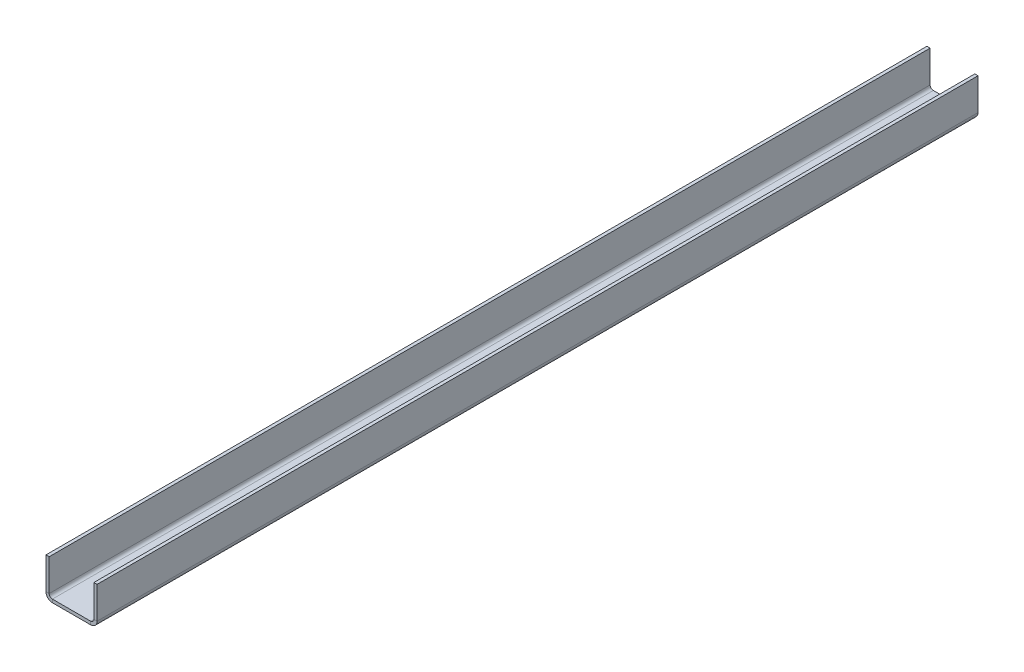
from build123d import *

# Parameters (mm, degrees)
BASE_FLANGE1_DEPTH = 876.3


# Sheet-metal steps are written as plain solids
with BuildPart() as part:
    # Sketch1 → Base-Flange1 (new body)
    with BuildSketch(Plane.XY):
        with BuildLine():
            Line((50.8, 38.1), (50.8, 6.35))
            ThreePointArc((50.8, 6.35), (48.940128061, 1.859871939), (44.45, 0))
            Line((44.45, 0), (6.35, 0))
            ThreePointArc((6.35, 0), (1.859871939, 1.859871939), (0, 6.35))
            Line((0, 6.35), (0, 38.1))
            Line((0, 38.1), (3.175, 38.1))
            Line((3.175, 38.1), (3.175, 6.35))
            ThreePointArc((3.175, 6.35), (4.10493597, 4.10493597), (6.35, 3.175))
            Line((6.35, 3.175), (44.45, 3.175))
            ThreePointArc((44.45, 3.175), (46.69506403, 4.10493597), (47.625, 6.35))
            Line((47.625, 6.35), (47.625, 38.1))
            Line((47.625, 38.1), (50.8, 38.1))
        make_face()
    extrude(amount=BASE_FLANGE1_DEPTH)


solid = part.part
